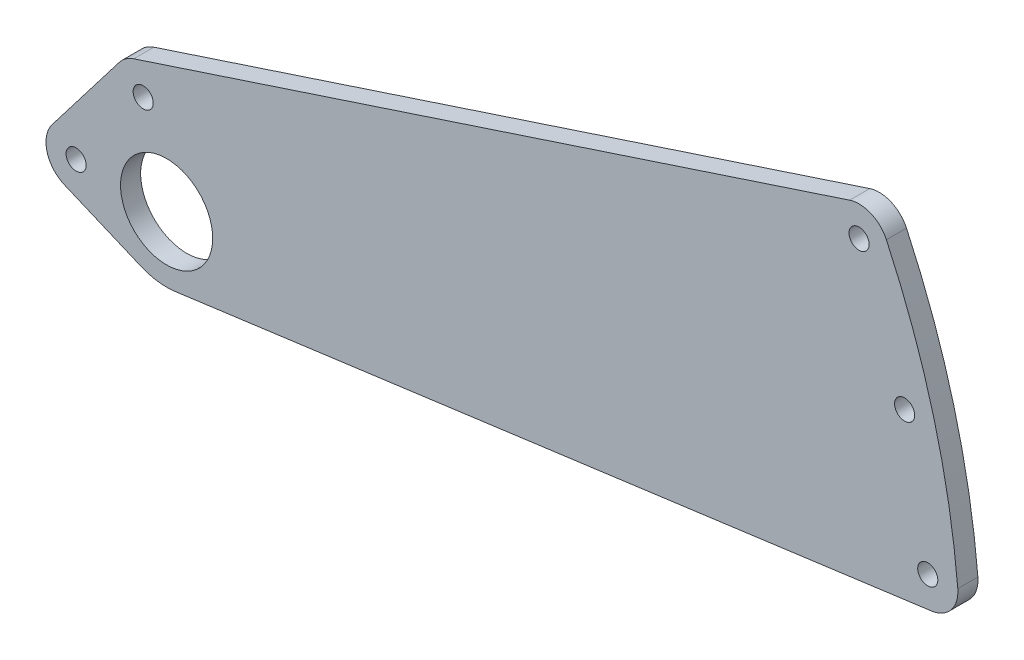
from build123d import *

# Parameters (mm, degrees)
SKETCH1_R           = 14.5542
SKETCH1_R_2         = 3.175
BOSS_EXTRUDE1_DEPTH = 6.35


with BuildPart() as part:
    # Sketch1 → Boss-Extrude1 (new body)
    with BuildSketch(Plane.XY):
        with BuildLine():
            Line((-36.131690566, 5.798452611), (-14.95244478, 33.399783098))
            ThreePointArc((-14.95244478, 33.399783098), (-12.907289703, 35.369766722), (-10.372281426, 36.649308755))
            Line((-10.372281426, 36.649308755), (215.715541799, 111.025764827))
            ThreePointArc((215.715541799, 111.025764827), (222.474160144, 110.71972065), (227.324650683, 106.003225501))
            ThreePointArc((227.324650683, 106.003225501), (242.278345379, 64.918286988), (249.870535149, 21.860839175))
            ThreePointArc((249.870535149, 21.860839175), (247.817435549, 15.077810727), (241.648040428, 11.590224636))
            Line((241.648040428, 11.590224636), (2.743562854, -20.454321527))
            ThreePointArc((2.743562854, -20.454321527), (-2.73762153, -20.455117565), (-8.025694444, -19.013012253))
            Line((-8.025694444, -19.013012253), (-32.279166667, -8.775236424))
            ThreePointArc((-32.279166667, -8.775236424), (-37.783682285, -2.434295702), (-36.131690566, 5.798452611))
        make_face()
        Circle(SKETCH1_R, mode=Mode.SUBTRACT)
        with Locations((-28.575, 0)):
            Circle(SKETCH1_R_2, mode=Mode.SUBTRACT)
        with Locations((-7.395754214, 27.601330486)):
            Circle(SKETCH1_R_2, mode=Mode.SUBTRACT)
        with Locations((240.38178065, 21.030680725)):
            Circle(SKETCH1_R_2, mode=Mode.SUBTRACT)
        with Locations((233.077901884, 62.453035583)):
            Circle(SKETCH1_R_2, mode=Mode.SUBTRACT)
        with Locations((218.692069012, 101.977786558)):
            Circle(SKETCH1_R_2, mode=Mode.SUBTRACT)
    extrude(amount=BOSS_EXTRUDE1_DEPTH)


solid = part.part
